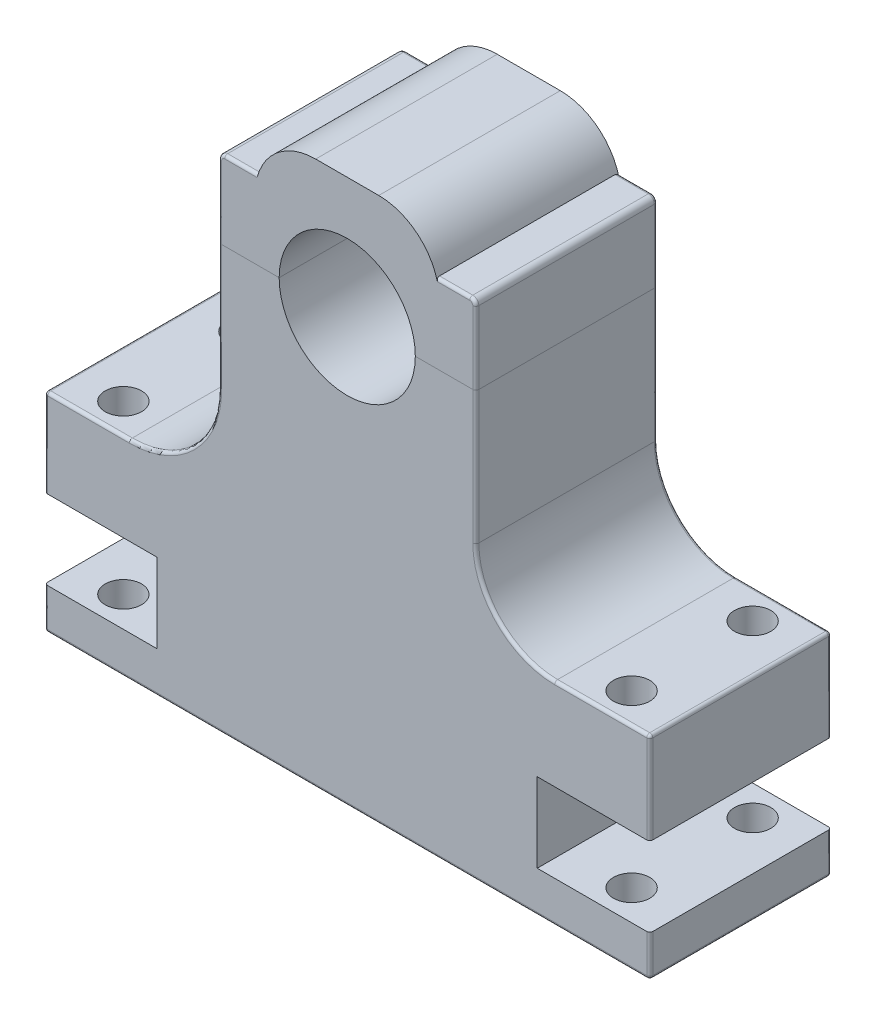
from build123d import *

# Parameters (mm, degrees)
ESQUISSE1_R             = 112.5
BOSS_EXTRU_1_DEPTH      = 300
ESQUISSE2_R             = 30
ENL_V_MAT_EXTRU_1_DEPTH = 500
CONG_3_R                = 100
CONG_4_R                = 10
ESQUISSE3_R             = 30
ENL_V_MAT_EXTRU_2_DEPTH = 1181.042372121
ESQUISSE6_W             = 1000
ESQUISSE6_H             = 200
BOSS_EXTRU_2_DEPTH      = 300
ESQUISSE7_R             = 33.126631207
ESQUISSE7_R_2           = 30
ENL_V_MAT_EXTRU_4_DEPTH = 300
CONG_6_R                = 5
ESQUISSE12_W            = 450.728813559
ESQUISSE12_H            = 131
ENL_V_MAT_EXTRU_5_DEPTH = 1257.980509077


with BuildPart() as part:
    # Esquisse1 → Boss.-Extru.1 (new body)
    with BuildSketch(Plane.XY):
        with BuildLine():
            Line((0, 0), (1000, 0))
            Line((1000, 0), (1000, 150))
            Line((1000, 150), (842.778028845, 150))
            ThreePointArc((842.778028845, 150), (750.657551209, 188.157551209), (712.5, 280.278028845))
            Line((712.5, 280.278028845), (712.5, 375))
            Line((712.5, 375), (712.5, 630))
            Line((712.5, 630), (647.5, 630))
            Line((647.5, 630), (647.5, 700))
            Line((647.5, 700), (352.5, 700))
            Line((352.5, 700), (352.5, 630))
            Line((352.5, 630), (287.5, 630))
            Line((287.5, 630), (287.5, 374.917655942))
            Line((287.5, 374.917655942), (287.5, 291.854042173))
            ThreePointArc((287.5, 291.854042173), (244.292071963, 187.540876304), (139.978906094, 144.332948267))
            Line((139.978906094, 144.332948267), (0, 144.332948267))
            Line((0, 144.332948267), (0, 0))
        make_face()
        with Locations((500, 500)):
            Circle(ESQUISSE1_R, mode=Mode.SUBTRACT)
    extrude(amount=-BOSS_EXTRU_1_DEPTH)

    # Esquisse2 → Enlèv. mat.-Extru.1 (cut)
    with BuildSketch(Plane(origin=(0, 144.332948267, 0), x_dir=(1, 0, 0), z_dir=(0, 1, 0))):
        with Locations(Location((80, 250, 0), (0, 0, 270))):
            Circle(ESQUISSE2_R)
        with Locations(Location((80, 50, 0), (0, 0, 270))):
            Circle(ESQUISSE2_R)
    extrude(amount=-ENL_V_MAT_EXTRU_1_DEPTH, mode=Mode.SUBTRACT)

    # Congé3
    # the kernel refuses this fillet: 100 mm, written as the material it takes off along each edge
    with BuildSketch(Plane(origin=(352.5, 700, 238.484800354), x_dir=(1, 0, 0), z_dir=(0, 0, -1))) as cong_3_piece_1:
        with BuildLine():
            CenterArc((95.393920142, 100), CONG_3_R, 197.457603124, 72.542396876)
            Line((0, 70), (-1.907878403, 69.4))
            ThreePointArc((-1.907878403, 69.4), (-2, 35), (-2, 0))
            Line((-2, 0), (0, -2))
            Line((0, -2), (95.393920142, -2))
            Line((95.393920142, -2), (95.393920142, 0))
        make_face()
    extrude(amount=776.969600708, mode=Mode.SUBTRACT)
    with BuildSketch(Plane(origin=(647.5, 700, 238.484800354), x_dir=(0, -1, 0), z_dir=(0, 0, -1))) as cong_3_piece_2:
        with BuildLine():
            CenterArc((100, 95.393920142), CONG_3_R, 180, 72.542396876)
            Line((0, 95.393920142), (-2, 95.393920142))
            Line((-2, 95.393920142), (-2, 0))
            Line((-2, 0), (0, -2))
            ThreePointArc((0, -2), (35, -2), (69.4, -1.907878403))
            Line((69.4, -1.907878403), (70, 0))
        make_face()
    extrude(amount=776.969600708, mode=Mode.SUBTRACT)

    # Congé4
    cong_4_edges = [part.edges().sort_by_distance(p)[0] for p in [
        (287.5, 630, -150),
        (712.5, 630, -150),
    ]]
    fillet(cong_4_edges, radius=CONG_4_R)

    # Esquisse3 → Enlèv. mat.-Extru.2 (cut, through all)
    with BuildSketch(Plane(origin=(0, 150, 0), x_dir=(1, 0, 0), z_dir=(0, 1, 0))):
        with Locations(Location((920, 250, 0), (0, 0, 270))):
            Circle(ESQUISSE3_R)
        with Locations(Location((920, 50, 0), (0, 0, 270))):
            Circle(ESQUISSE3_R)
    extrude(amount=-ENL_V_MAT_EXTRU_2_DEPTH, mode=Mode.SUBTRACT)

    # Esquisse6 → Boss.-Extru.2 (add)
    with BuildSketch(Plane.XY):
        with Locations((500, -100)):
            Rectangle(ESQUISSE6_W, ESQUISSE6_H)
    extrude(amount=-BOSS_EXTRU_2_DEPTH)

    # Esquisse7 → Enlèv. mat.-Extru.4 (cut)
    with BuildSketch(Plane(origin=(0, 0, 0), x_dir=(1, 0, 0), z_dir=(0, 1, 0))):
        with Locations(Location((80.66253765, 253.05562867, 0), (0, 0, 257.766195301))):
            Circle(ESQUISSE7_R)
        with Locations(Location((80, 50, 0), (0, 0, 270))):
            Circle(ESQUISSE7_R_2)
        with Locations(Location((920, 250, 0), (0, 0, 270))):
            Circle(ESQUISSE7_R_2)
        with Locations(Location((920, 50, 0), (0, 0, 270))):
            Circle(ESQUISSE7_R_2)
    extrude(amount=-ENL_V_MAT_EXTRU_4_DEPTH, mode=Mode.SUBTRACT)

    # Congé6
    cong_6_edges = [part.edges().sort_by_distance(p)[0] for p in [
        (1000, -25, -300),
        (69.989453047, 144.332948267, 0),
        (244.292071963, 187.540876304, 0),
        (921.389014422, 150, -300),
        (325, 630, 0),
        (712.5, 450.139014422, 0),
        (750.657551209, 188.157551209, 0),
        (921.389014422, 150, 0),
        (750.657551209, 188.157551209, -300),
        (1000, -25, 0),
        (0, -27.833525867, 0),
        (712.5, 450.139014422, -300),
        (0, 144.332948267, -150),
        (1000, 150, -150),
        (325, 630, -300),
        (0, -27.833525867, -300),
        (244.292071963, 187.540876304, -300),
        (69.989453047, 144.332948267, -300),
        (287.5, 455.927021086, 0),
        (675, 630, 0),
        (709.571067812, 627.071067812, 0),
        (290.428932188, 627.071067812, 0),
        (287.5, 455.927021086, -300),
        (675, 630, -300),
        (709.571067812, 627.071067812, -300),
        (290.428932188, 627.071067812, -300),
        (500, -200, -300),
        (1000, -200, -150),
        (0, -200, -150),
        (500, -200, 0),
    ]]
    fillet(cong_6_edges, radius=CONG_6_R)


with BuildPart() as body_2:
    # Fractionner1: the piece on the far side of the plane
    add(part.part)
    split(bisect_by=Plane(origin=(0, 500, 0), x_dir=(0, 0, -1), z_dir=(0, -1, 0)), keep=Keep.BOTTOM)


with BuildPart() as part_1:
    add(part.part)

    # Fractionner1
    split(bisect_by=Plane(origin=(0, 500, 0), x_dir=(0, 0, -1), z_dir=(0, -1, 0)), keep=Keep.TOP)

    # Esquisse12 → Enlèv. mat.-Extru.5 (cut, through all)
    with BuildSketch(Plane(origin=(0, 0, -300), x_dir=(-1, 0, 0), z_dir=(0, 0, -1))):
        with Locations((39.36440678, -66.5)):
            Rectangle(ESQUISSE12_W, ESQUISSE12_H)
        with Locations((-1039.36440678, -66.5)):
            Rectangle(ESQUISSE12_W, ESQUISSE12_H)
    extrude(amount=-ENL_V_MAT_EXTRU_5_DEPTH, mode=Mode.SUBTRACT)


solid = Compound([body_2.part, part_1.part])
